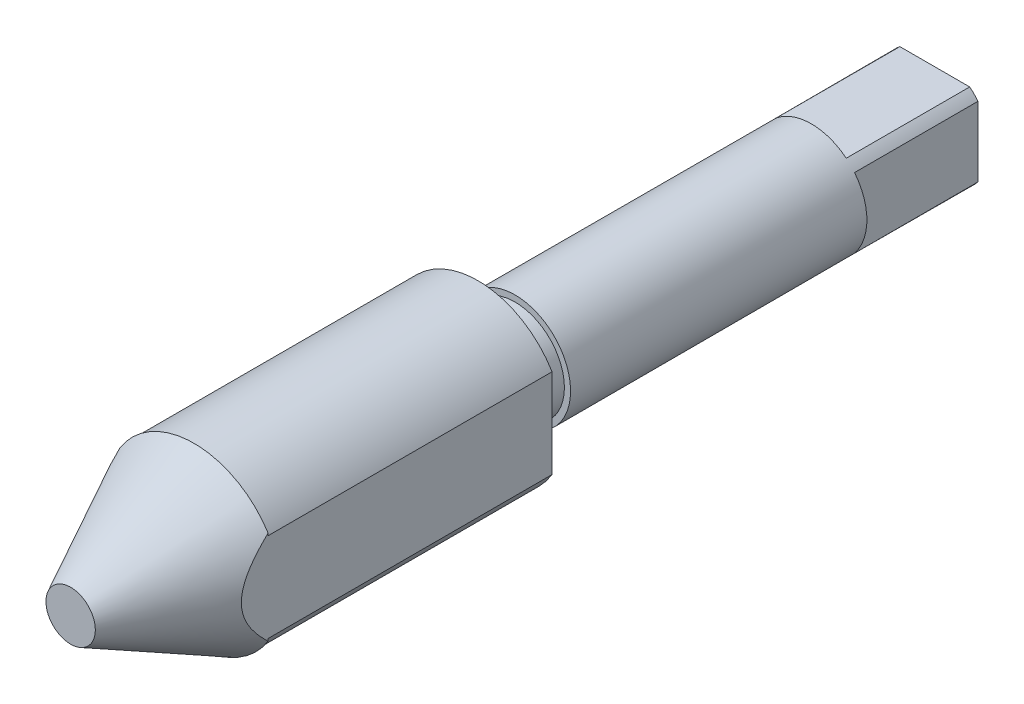
from build123d import *

# Parameters (mm, degrees)
SKETCH_1_R            = 4.5
EXTRUDE_1_DEPTH       = 34
SKETCH_2_R            = 4
EXTRUDE_2_DEPTH       = 3
EXTRUDE_3_DEPTH       = 23
SKETCH_1_2_R          = 2
EXTRUDE_4_DEPTH       = 10
EXTRUDE_4_DRAFT       = 27
SKETCH_7_W            = 1.79623407
SKETCH_7_H            = 9.81557087
SKETCH_7_W_2          = 2.958566665
SKETCH_7_H_2          = 10.839995421
CUT_EXTRUDE_14_DEPTH  = 4
HOLE_WIZARD_M53_D     = 5.2
HOLE_WIZARD_M53_DEPTH = 13
HOLE_WIZARD_M53_TIP   = 1.562237609
SKETCH_16_R           = 10.346676453
SKETCH_16_W           = 7
SKETCH_16_H           = 7
CUT_EXTRUDE_15_DEPTH  = 10


with BuildPart() as part:
    # Эскиз1 → Бобышка-Вытянуть1 (new body)
    with BuildSketch(Plane.XY):
        Circle(SKETCH_1_R)
    extrude(amount=EXTRUDE_1_DEPTH)

    # Эскиз2 → Бобышка-Вытянуть2 (add)
    with BuildSketch(Plane.XY.offset(34)):
        Circle(SKETCH_2_R)
    extrude(amount=EXTRUDE_2_DEPTH)

    # Эскиз3 → Бобышка-Вытянуть3 (add)
    with BuildSketch(Plane.XY.offset(37)):
        with BuildLine():
            ThreePointArc((6, 3.605551275), (0, 7), (-6, 3.605551275))
            Line((-6, 3.605551275), (-6, -3.605551275))
            ThreePointArc((-6, -3.605551275), (0, -7), (6, -3.605551275))
            Line((6, -3.605551275), (6, 3.605551275))
        make_face()
    extrude(amount=EXTRUDE_3_DEPTH)


with BuildPart() as extrude_4_tool:
    # Sketch 1 2 → Бобышка-Вытянуть4 (with draft: the straight prism first)
    with BuildSketch(Plane(origin=(0.00751481, -0.003794932, 70), x_dir=(1, 0, 0), z_dir=(0, 0, 1))):
        Circle(SKETCH_1_2_R)
    extrude(amount=-EXTRUDE_4_DEPTH)
    # Бобышка-Вытянуть4: the draft: its side faces are tilted about the plane it starts from
    extrude_4_sides = [extrude_4_tool.faces().sort_by_distance(p)[0] for p in [
        (-1.99248519, -0.003794932, 65),
    ]]
    draft(extrude_4_sides, Plane(origin=(0.00751481, -0.003794932, 70), x_dir=(1, 0, 0), z_dir=(0, 0, 1)), EXTRUDE_4_DRAFT)


with BuildPart() as part_1:
    add(part.part)

    # Бобышка-Вытянуть4: add extrude_4_tool
    add(extrude_4_tool.part)

    # Эскиз7 → Вырез-Вытянуть14 (cut)
    with BuildSketch(Plane(origin=(0, 0, 60), x_dir=(-1, 0, 0), z_dir=(0, 0, -1))):
        with Locations((-6.898117035, 0.517903439)):
            Rectangle(SKETCH_7_W, SKETCH_7_H)
        with Locations((7.479283333, -1.183503448)):
            Rectangle(SKETCH_7_W_2, SKETCH_7_H_2)
    extrude(amount=-CUT_EXTRUDE_14_DEPTH, mode=Mode.SUBTRACT)

    # Сверло под метчик  спиральное M53
    with Locations(Plane(origin=(0, 0, 0), x_dir=(-1, 0, 0), z_dir=(0, 0, -1))):
        with Locations((0, 0)):
            Hole(HOLE_WIZARD_M53_D / 2, depth=HOLE_WIZARD_M53_DEPTH)
            with Locations((0, 0, -(HOLE_WIZARD_M53_DEPTH + HOLE_WIZARD_M53_TIP / 2))):  # 118° drill point
                Cone(0, HOLE_WIZARD_M53_D / 2, HOLE_WIZARD_M53_TIP, mode=Mode.SUBTRACT)

    # Эскиз16 → Вырез-Вытянуть15 (cut)
    with BuildSketch(Plane(origin=(0, 0, 0), x_dir=(-1, 0, 0), z_dir=(0, 0, -1))):
        Circle(SKETCH_16_R)
        Rectangle(SKETCH_16_W, SKETCH_16_H, mode=Mode.SUBTRACT)
    extrude(amount=-CUT_EXTRUDE_15_DEPTH, mode=Mode.SUBTRACT)


solid = part_1.part
